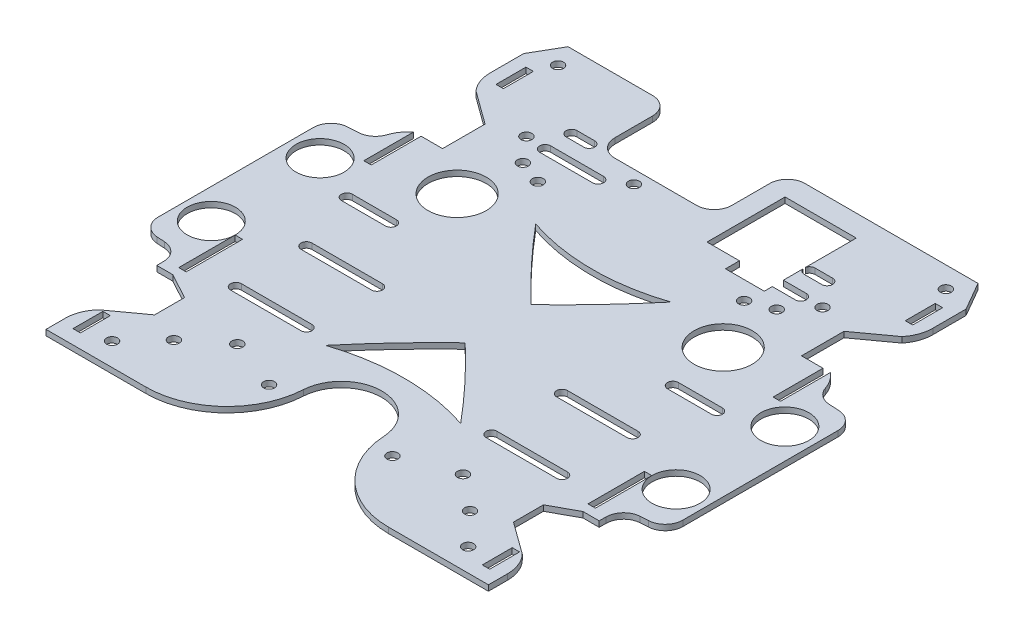
from build123d import *

# Parameters (mm, degrees)
SKETCH1_W              = 2.1
SKETCH1_H              = 8.5
SKETCH1_R              = 1.550000001
SKETCH1_R_2            = 1.55
EXTRUDE_3119_DEPTH     = 1.6
SKETCH_1_W             = 33.213467336
SKETCH_1_H             = 20.75
CUT_EXTRUDE_5204_DEPTH = 109.487014406
FILLET1_R              = 10
SKETCH_4543_R          = 1.55
CUT_EXTRUDE_5890_DEPTH = 109.487014406
CUT_EXTRUDE_6227_DEPTH = 109.487014406
SKETCH_6369_R          = 8.25
SKETCH_6369_R_2        = 6.825
EXTRUDE_6784_DEPTH     = 1.6
SKETCH_2_R             = 6.825
SKETCH_2_R_2           = 8.25
CUT_EXTRUDE_7139_DEPTH = 116.632825874
FILLET2_R              = 5
SKETCH4_W              = 2.1
SKETCH4_H              = 7.5
F_7_5MM_DEPTH          = 116.632825874
FILLET3_R              = 5


with BuildPart() as part:
    # Sketch1 → Extrude 3119 (new body)
    with BuildSketch(Plane(origin=(0, 0, 0), x_dir=(1, 0, 0), z_dir=(0, 1, 0))):
        with BuildLine():
            Line((-62.75, 0), (-62.75, -55))
            Line((-62.75, -55), (-34.369560329, -55))
            ThreePointArc((-34.369560329, -55), (-18.59120626, -48.721265785), (-11.440696816, -33.31837076))
            ThreePointArc((-11.440696816, -33.31837076), (-7.872843983, -25.632867641), (0, -22.5))
            ThreePointArc((0, -22.5), (7.872843983, -25.632867641), (11.440696816, -33.31837076))
            ThreePointArc((11.440696816, -33.31837076), (18.59120626, -48.721265785), (34.369560329, -55))
            Line((34.369560329, -55), (62.75, -55))
            Line((62.75, -55), (62.75, 0))
            Line((62.75, 0), (62.75, 80.5))
            Line((62.75, 80.5), (58.140789302, 88.483387111))
            Line((58.140789302, 88.483387111), (-58.140789302, 88.483387111))
            Line((-58.140789302, 88.483387111), (-62.75, 80.5))
            Line((-62.75, 80.5), (-62.75, 0))
        make_face()
        with Locations((-58.05, -46.75)):
            Rectangle(SKETCH1_W, SKETCH1_H, mode=Mode.SUBTRACT)
        with Locations(Location((-42.00000001, -39.477654565, 0), (0, 0, 270))):
            Circle(SKETCH1_R, mode=Mode.SUBTRACT)
        with Locations(Location((-31.999999979, -31.477654469, 0), (0, 0, 270))):
            Circle(SKETCH1_R, mode=Mode.SUBTRACT)
        with Locations(Location((-17.5, -36.97765453, 0), (0, 0, 270))):
            Circle(SKETCH1_R_2, mode=Mode.SUBTRACT)
        with Locations((-58.05, -16.75)):
            Rectangle(SKETCH1_W, SKETCH1_H, mode=Mode.SUBTRACT)
        with Locations(Location((17.5, -36.97765453, 0), (0, 0, 270))):
            Circle(SKETCH1_R_2, mode=Mode.SUBTRACT)
        with Locations(Location((42.00000001, -39.477654565, 0), (0, 0, 270))):
            Circle(SKETCH1_R, mode=Mode.SUBTRACT)
        with Locations((58.05, -46.75)):
            Rectangle(SKETCH1_W, SKETCH1_H, mode=Mode.SUBTRACT)
        with Locations(Location((31.999999979, -31.477654469, 0), (0, 0, 270))):
            Circle(SKETCH1_R, mode=Mode.SUBTRACT)
        with Locations((58.05, -16.75)):
            Rectangle(SKETCH1_W, SKETCH1_H, mode=Mode.SUBTRACT)
        with Locations((-58.05, 43.25)):
            Rectangle(SKETCH1_W, SKETCH1_H, mode=Mode.SUBTRACT)
        with Locations(Location((-29.250000127, 51.022345452, 0), (0, 0, 270))):
            Circle(SKETCH1_R_2, mode=Mode.SUBTRACT)
        with Locations(Location((-42.00000014, 60.522345435, 0), (0, 0, 270))):
            Circle(SKETCH1_R, mode=Mode.SUBTRACT)
        with Locations(Location((-36.00000013, 53.522345443, 0), (0, 0, 270))):
            Circle(SKETCH1_R, mode=Mode.SUBTRACT)
        with Locations((-58.05, 73.25)):
            Rectangle(SKETCH1_W, SKETCH1_H, mode=Mode.SUBTRACT)
        with Locations(Location((-15.000000144, 64.02234547, 0), (0, 0, 270))):
            Circle(SKETCH1_R_2, mode=Mode.SUBTRACT)
        with Locations(Location((29.250000127, 51.022345452, 0), (0, 0, 270))):
            Circle(SKETCH1_R, mode=Mode.SUBTRACT)
        with Locations((58.05, 43.25)):
            Rectangle(SKETCH1_W, SKETCH1_H, mode=Mode.SUBTRACT)
        Polygon((9.55, 60.2), (9.55, 82.35), (29.75, 82.35), (29.75, 56.25), (18.75, 56.25), (18.75, 60.2), align=None, mode=Mode.SUBTRACT)
        with Locations(Location((36.00000013, 53.522345443, 0), (0, 0, 270))):
            Circle(SKETCH1_R, mode=Mode.SUBTRACT)
        with Locations(Location((42.00000014, 60.522345435, 0), (0, 0, 270))):
            Circle(SKETCH1_R, mode=Mode.SUBTRACT)
        with Locations((58.05, 73.25)):
            Rectangle(SKETCH1_W, SKETCH1_H, mode=Mode.SUBTRACT)
    extrude(amount=EXTRUDE_3119_DEPTH)

    # 外部切除点示意-1 → Cut-Extrude 5204 (cut, through all)
    with BuildSketch(Plane(origin=(0, 0, 0), x_dir=(1, 0, 0), z_dir=(0, 1, 0))):
        with Locations((-12.540081807, 78.108387111)):
            Rectangle(SKETCH_1_W, SKETCH_1_H)
        Polygon((-62.75, 45.651396111), (-62.75, 64.6074084), (-60.40596468, 64.6074084), (-50.906199984, 57.705425363), (-50.906199984, 45.651396111), align=None)
        Polygon((60.40596468, 64.6074084), (50.906199984, 57.705425363), (50.906199984, 45.651396111), (62.75, 45.651396111), (62.75, 64.6074084), align=None)
        Polygon((-60.003668341, -42.652398311), (-62.75, -42.652398311), (-62.75, -23.579530262), (-58.186951748, -23.579530262), (-50.906199866, -27.548162789), (-50.906199866, -36.042700547), align=None)
        Polygon((62.75, -23.579530262), (58.186951748, -23.579530262), (50.906199866, -27.548162789), (50.906199866, -36.042700547), (60.003668341, -42.652398311), (62.75, -42.652398311), align=None)
        with BuildLine():
            ThreePointArc((-62.75, 28.319513771), (-58.732052073, 10.484483949), (-62.75, -7.350545872))
            Line((-62.75, -7.350545872), (-62.75, 28.319513771))
        make_face()
        with BuildLine():
            Line((62.75, 28.319513771), (62.75, -7.350545872))
            ThreePointArc((62.75, -7.350545872), (58.732052073, 10.484483949), (62.75, 28.319513771))
        make_face()
    extrude(amount=CUT_EXTRUDE_5204_DEPTH, mode=Mode.SUBTRACT)

    # Fillet1
    # the kernel refuses this fillet: 10 mm, written as the material it takes off along each edge
    with BuildSketch(Plane(origin=(62.75, -5.315284037, 7.350545872), x_dir=(-0.40796037276292024, 0, -0.912999635407999), z_dir=(0, 1, 0)), Plane(origin=(-62.75, -5.315284037, -28.319513771), x_dir=(0.40796037276292013, 0, 0.9129996354079991), z_dir=(0, 1, 0))) as fillet1_piece_1:
        with BuildLine():
            CenterArc((2.138462772, 9.997366457), FILLET1_R, 245.92322715, 22.761798212)
            Line((-1.941140955, 0.867370103), (-2.02273303, 0.684770176))
            Line((-2.02273303, 0.684770176), (-0.081592075, -0.182599927))
            Line((-0.081592075, -0.182599927), (0.004589724, -0.199947329))
            ThreePointArc((0.004589724, -0.199947329), (0.954488275, -0.189046462), (1.904386825, -0.199947329))
            Line((1.904386825, -0.199947329), (1.90897655, 0))
        make_face()
    extrude(amount=12.230568074, mode=Mode.SUBTRACT)
    with BuildSketch(Plane(origin=(62.75, -5.315284037, -28.319513771), x_dir=(0, 0, -1), z_dir=(0, 1, 0)), Plane(origin=(-62.75, -5.315284037, 7.350545872), x_dir=(0, 0, 1), z_dir=(0, 1, 0))) as fillet1_piece_2:
        with BuildLine():
            CenterArc((2.126113615, 10), FILLET1_R, 247.238201788, 22.761798212)
            Line((-1.742894894, 0.778786785), (-1.820275064, 0.594362521))
            ThreePointArc((-1.820275064, 0.594362521), (-0.948570912, 0.216794041), (-0.085761004, -0.180679413))
            Line((-0.085761004, -0.180679413), (0, -0.2))
            Line((0, -0.2), (2.126113615, -0.2))
            Line((2.126113615, -0.2), (2.126113615, 0))
        make_face()
    extrude(amount=12.230568074, mode=Mode.SUBTRACT)
    with BuildSketch(Plane(origin=(62.75, -17.209062946, 42.652398311), x_dir=(-1, 0, 0), z_dir=(0, 1, 0))) as fillet1_piece_3:
        with BuildLine():
            CenterArc((10, 6.883625179), FILLET1_R, 180, 43.500627337)
            Line((0, 6.883625179), (-0.2, 6.883625179))
            Line((-0.2, 6.883625179), (-0.2, 0))
            Line((-0.2, 0), (0, -0.2))
            ThreePointArc((0, -0.2), (1.373165829, -0.2), (2.601258292, -0.137672504))
            Line((2.601258292, -0.137672504), (2.746331659, 0))
        make_face()
    extrude(amount=36.018125893, mode=Mode.SUBTRACT)
    with BuildSketch(Plane(origin=(-62.75, -17.209062946, 42.652398311), x_dir=(0, 0, 1), z_dir=(0, 1, 0))) as fillet1_piece_4:
        with BuildLine():
            CenterArc((6.883625179, 10), FILLET1_R, 226.499372663, 43.500627337)
            Line((0, 2.746331659), (-0.137672504, 2.601258292))
            ThreePointArc((-0.137672504, 2.601258292), (-0.2, 1.373165829), (-0.2, 0))
            Line((-0.2, 0), (0, -0.2))
            Line((0, -0.2), (6.883625179, -0.2))
            Line((6.883625179, -0.2), (6.883625179, 0))
        make_face()
    extrude(amount=36.018125893, mode=Mode.SUBTRACT)
    with BuildSketch(Plane(origin=(62.75, -19.312803396, -45.651396111), x_dir=(-1, 0, 0), z_dir=(0, 1, 0))) as fillet1_piece_5:
        with BuildLine():
            CenterArc((10, 7.725121358), FILLET1_R, 180, 50.580015533)
            Line((0, 7.725121358), (-0.2, 7.725121358))
            Line((-0.2, 7.725121358), (-0.2, 0))
            Line((-0.2, 0), (0, -0.2))
            ThreePointArc((0, -0.2), (1.825, -0.2), (3.523, -0.154502427))
            Line((3.523, -0.154502427), (3.65, 0))
        make_face()
    extrude(amount=40.225606791, mode=Mode.SUBTRACT)
    with BuildSketch(Plane(origin=(62.75, -16.083027705, -64.6074084), x_dir=(0, 0, -1), z_dir=(0, 1, 0))) as fillet1_piece_6:
        with BuildLine():
            CenterArc((6.433211082, 10), FILLET1_R, 229.960085669, 40.039914331)
            Line((0, 2.34403532), (-0.128664222, 2.190916027))
            ThreePointArc((-0.128664222, 2.190916027), (-0.2, 1.17201766), (-0.2, 0))
            Line((-0.2, 0), (0, -0.2))
            Line((0, -0.2), (6.433211082, -0.2))
            Line((6.433211082, -0.2), (6.433211082, 0))
        make_face()
    extrude(amount=33.766055409, mode=Mode.SUBTRACT)
    with BuildSketch(Plane(origin=(-62.75, -19.312803396, -45.651396111), x_dir=(0, 0, 1), z_dir=(0, 1, 0))) as fillet1_piece_7:
        with BuildLine():
            CenterArc((7.725121358, 10), FILLET1_R, 219.419984467, 50.580015533)
            Line((0, 3.65), (-0.154502427, 3.523))
            ThreePointArc((-0.154502427, 3.523), (-0.2, 1.825), (-0.2, 0))
            Line((-0.2, 0), (0, -0.2))
            Line((0, -0.2), (7.725121358, -0.2))
            Line((7.725121358, -0.2), (7.725121358, 0))
        make_face()
    extrude(amount=40.225606791, mode=Mode.SUBTRACT)
    with BuildSketch(Plane(origin=(-62.75, -16.083027705, -64.6074084), x_dir=(1, 0, 0), z_dir=(0, 1, 0))) as fillet1_piece_8:
        with BuildLine():
            CenterArc((10, 6.433211082), FILLET1_R, 180, 40.039914331)
            Line((0, 6.433211082), (-0.2, 6.433211082))
            Line((-0.2, 6.433211082), (-0.2, 0))
            Line((-0.2, 0), (0, -0.2))
            ThreePointArc((0, -0.2), (1.17201766, -0.2), (2.190916027, -0.128664222))
            Line((2.190916027, -0.128664222), (2.34403532, 0))
        make_face()
    extrude(amount=33.766055409, mode=Mode.SUBTRACT)

    # Sketch 4543 → Cut-Extrude 5890 (cut, through all)
    with BuildSketch(Plane(origin=(0, 0, 0), x_dir=(1, 0, 0), z_dir=(0, 1, 0))):
        with Locations(Location((55, 82.5, 0), (0, 0, 270))):
            Circle(SKETCH_4543_R)
        with Locations(Location((-55, 82.5, 0), (0, 0, 90))):
            Circle(SKETCH_4543_R)
        with Locations(Location((50.5, -48.5, 0), (0, 0, 270))):
            Circle(SKETCH_4543_R)
        with Locations(Location((-50.5, -48.5, 0), (0, 0, 90))):
            Circle(SKETCH_4543_R)
        with BuildLine():
            Line((-36.25, 69.144689121), (-31.25, 69.144689121))
            ThreePointArc((-31.25, 69.144689121), (-29.7, 67.594689121), (-31.25, 66.044689121))
            Line((-31.25, 66.044689121), (-36.25, 66.044689121))
            ThreePointArc((-36.25, 66.044689121), (-37.8, 67.594689121), (-36.25, 69.144689121))
        make_face()
        with BuildLine():
            Line((36.25, 69.144689121), (31.25, 69.144689121))
            ThreePointArc((31.25, 69.144689121), (29.7, 67.594689121), (31.25, 66.044689121))
            Line((31.25, 66.044689121), (36.25, 66.044689121))
            ThreePointArc((36.25, 66.044689121), (37.8, 67.594689121), (36.25, 69.144689121))
        make_face()
        with BuildLine():
            Line((-36.25, 61.664776125), (-21.25, 61.664776125))
            ThreePointArc((-21.25, 61.664776125), (-19.679912997, 60.094689121), (-21.25, 58.524602118))
            Line((-21.25, 58.524602118), (-36.25, 58.524602118))
            ThreePointArc((-36.25, 58.524602118), (-37.820087003, 60.094689121), (-36.25, 61.664776125))
        make_face()
        with BuildLine():
            Line((36.25, 61.664776125), (21.25, 61.664776125))
            ThreePointArc((21.25, 61.664776125), (19.679912997, 60.094689121), (21.25, 58.524602118))
            Line((21.25, 58.524602118), (36.25, 58.524602118))
            ThreePointArc((36.25, 58.524602118), (37.820087003, 60.094689121), (36.25, 61.664776125))
        make_face()
        with BuildLine():
            Line((-52.5, 21.644689121), (-40, 21.644689121))
            ThreePointArc((-40, 21.644689121), (-38.45, 20.094689121), (-40, 18.544689121))
            Line((-40, 18.544689121), (-52.5, 18.544689121))
            ThreePointArc((-52.5, 18.544689121), (-54.05, 20.094689121), (-52.5, 21.644689121))
        make_face()
        with BuildLine():
            Line((-46.25, -16.06629686), (-26.25, -16.06629686))
            ThreePointArc((-26.25, -16.06629686), (-24.7, -17.61629686), (-26.25, -19.16629686))
            Line((-26.25, -19.16629686), (-46.25, -19.16629686))
            ThreePointArc((-46.25, -19.16629686), (-47.8, -17.61629686), (-46.25, -16.06629686))
        make_face()
        with BuildLine():
            Line((46.25, -16.06629686), (26.25, -16.06629686))
            ThreePointArc((26.25, -16.06629686), (24.7, -17.61629686), (26.25, -19.16629686))
            Line((26.25, -19.16629686), (46.25, -19.16629686))
            ThreePointArc((46.25, -19.16629686), (47.8, -17.61629686), (46.25, -16.06629686))
        make_face()
        with BuildLine():
            Line((52.5, 21.644689121), (40, 21.644689121))
            ThreePointArc((40, 21.644689121), (38.45, 20.094689121), (40, 18.544689121))
            Line((40, 18.544689121), (52.5, 18.544689121))
            ThreePointArc((52.5, 18.544689121), (54.05, 20.094689121), (52.5, 21.644689121))
        make_face()
        with BuildLine():
            Line((-46.25, 3.93370314), (-26.25, 3.93370314))
            ThreePointArc((-26.25, 3.93370314), (-24.7, 2.38370314), (-26.25, 0.83370314))
            Line((-26.25, 0.83370314), (-46.25, 0.83370314))
            ThreePointArc((-46.25, 0.83370314), (-47.8, 2.38370314), (-46.25, 3.93370314))
        make_face()
        with BuildLine():
            Line((46.25, 3.93370314), (26.25, 3.93370314))
            ThreePointArc((26.25, 3.93370314), (24.7, 2.38370314), (26.25, 0.83370314))
            Line((26.25, 0.83370314), (46.25, 0.83370314))
            ThreePointArc((46.25, 0.83370314), (47.8, 2.38370314), (46.25, 3.93370314))
        make_face()
    extrude(amount=CUT_EXTRUDE_5890_DEPTH, mode=Mode.SUBTRACT)

    # Sketch 5936 → Cut-Extrude 6227 (cut, through all)
    with BuildSketch(Plane(origin=(0, 1.6, 0), x_dir=(1, 0, 0), z_dir=(0, 1, 0))):
        with BuildLine():
            ThreePointArc((0, 1.150478295), (9.880413518, -8.800799981), (19.178947051, -19.297836932))
            ThreePointArc((19.178947051, -19.297836932), (0, -16.173740684), (-19.178947051, -19.297836932))
            ThreePointArc((-19.178947051, -19.297836932), (-9.880413518, -8.800799981), (0, 1.150478295))
        make_face()
        with BuildLine():
            ThreePointArc((0, 19.894212646), (-9.880413518, 29.845490922), (-19.178947051, 40.342527872))
            ThreePointArc((-19.178947051, 40.342527872), (0, 37.218431624), (19.178947051, 40.342527872))
            ThreePointArc((19.178947051, 40.342527872), (9.880413518, 29.845490922), (0, 19.894212646))
        make_face()
    extrude(amount=-CUT_EXTRUDE_6227_DEPTH, mode=Mode.SUBTRACT)

    # Sketch 6369 → Extrude 6784 (add)
    # profile 1 of 4: a face of its own
    with BuildSketch(Plane(origin=(0, 0, 0), x_dir=(1, 0, 0), z_dir=(0, 1, 0))):
        with Locations((-37.738926359, 36.604381126)):
            Circle(SKETCH_6369_R)
    # profile 2 of 4: a face of its own
    with BuildSketch(Plane(origin=(0, 0, 0), x_dir=(1, 0, 0), z_dir=(0, 1, 0))):
        with Locations((37.738926359, 36.604381126)):
            Circle(SKETCH_6369_R)
    # profile 3 of 4: a face of its own
    with BuildSketch(Plane(origin=(0, 0, 0), x_dir=(1, 0, 0), z_dir=(0, 1, 0))):
        Polygon((-62.75, 37.926274752), (-74.425, 37.199559832), (-74.425, -16.230591934), (-62.75, -16.957306854), (-62.75, -12.452180711), (-56.459208065, -7.780274515), (-56.459208065, 37.926274752), align=None)
        with Locations((-65.925, 25.912634289)):
            Circle(SKETCH_6369_R_2, mode=Mode.SUBTRACT)
        with Locations((-65.925, -4.94366639)):
            Circle(SKETCH_6369_R_2, mode=Mode.SUBTRACT)
    # profile 4 of 4: a face of its own
    with BuildSketch(Plane(origin=(0, 0, 0), x_dir=(1, 0, 0), z_dir=(0, 1, 0))):
        Polygon((56.459208065, -7.780274515), (62.75, -12.452180711), (62.75, -16.957306854), (74.425, -16.230591934), (74.425, 37.199559832), (62.75, 37.926274752), (56.459208065, 37.926274752), align=None)
        with Locations((65.925, -4.94366639)):
            Circle(SKETCH_6369_R_2, mode=Mode.SUBTRACT)
        with Locations((65.925, 25.912634289)):
            Circle(SKETCH_6369_R_2, mode=Mode.SUBTRACT)
    extrude(amount=EXTRUDE_6784_DEPTH)

    # 天线座-底部-草图<2> → Cut-Extrude 7139 (cut, through all)
    with BuildSketch(Plane(origin=(0, 0, 0), x_dir=(1, 0, 0), z_dir=(0, 1, 0))):
        with Locations(Location((-65.925, 25.912634289, 0), (0, 0, 270))):
            Circle(SKETCH_2_R)
        with Locations(Location((-65.925, -4.94366639, 0), (0, 0, 270))):
            Circle(SKETCH_2_R)
        with Locations(Location((65.925, 25.912634289, 0), (0, 0, 270))):
            Circle(SKETCH_2_R)
        with Locations(Location((65.925, -4.94366639, 0), (0, 0, 270))):
            Circle(SKETCH_2_R)
        with Locations(Location((-37.738926359, 36.604381126, 0), (0, 0, 270))):
            Circle(SKETCH_2_R_2)
        with Locations(Location((37.738926359, 36.604381126, 0), (0, 0, 270))):
            Circle(SKETCH_2_R_2)
    extrude(amount=CUT_EXTRUDE_7139_DEPTH, mode=Mode.SUBTRACT)

    # Fillet2
    fillet2_edges = [part.edges().sort_by_distance(p)[0] for p in [
        (62.75, 0.8, -37.926274752),
        (-62.75, 0.8, -37.926274752),
        (-74.425, 0.8, -37.199559832),
        (-62.75, 0.8, 16.957306854),
        (-74.425, 0.8, 16.230591934),
        (74.425, 0.8, -37.199559832),
        (74.425, 0.8, 16.230591934),
        (62.75, 0.8, 16.957306854),
    ]]
    fillet(fillet2_edges, radius=FILLET2_R)

    # Sketch4 → 额外榫卯-7.5mm (cut, through all)
    with BuildSketch(Plane(origin=(0, 1.6, 0), x_dir=(1, 0, 0), z_dir=(0, 1, 0))):
        with Locations((-58.05, 35.25)):
            Rectangle(SKETCH4_W, SKETCH4_H)
        with Locations((-58.05, -8.75)):
            Rectangle(SKETCH4_W, SKETCH4_H)
        with Locations((58.05, -8.75)):
            Rectangle(SKETCH4_W, SKETCH4_H)
        with Locations((58.05, 35.25)):
            Rectangle(SKETCH4_W, SKETCH4_H)
    extrude(amount=-F_7_5MM_DEPTH, mode=Mode.SUBTRACT)

    # Fillet3
    fillet3_edges = [part.edges().sort_by_distance(p)[0] for p in [
        (4.066651861, 0.8, -88.483387111),
        (-29.146815475, 0.8, -88.483387111),
        (-29.146815475, 0.8, -67.733387111),
        (4.066651861, 0.8, -67.733387111),
    ]]
    fillet(fillet3_edges, radius=FILLET3_R)


solid = part.part
